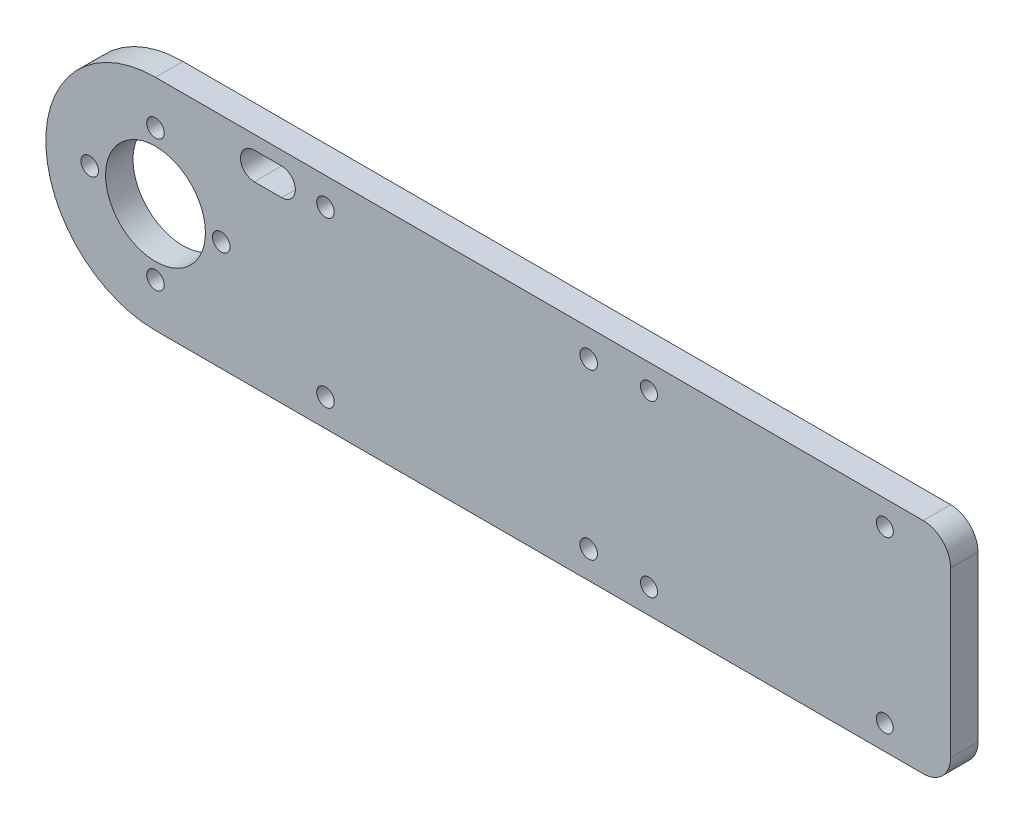
from build123d import *

# Parameters (mm, degrees)
SKETCH2_R           = 9.1
BOSS_EXTRUDE1_DEPTH = 2.5
FILLET1_R           = 5
SKETCH3_R           = 1.55
SKETCH3_R_2         = 1.6
CUT_EXTRUDE1_DEPTH  = 147.458185159
CUT_EXTRUDE2_DEPTH  = 10


with BuildPart() as part:
    # Sketch2 → Boss-Extrude1 (new, symmetric)
    with BuildSketch(Plane.XY):
        with BuildLine():
            Line((145, 20), (0, 20))
            ThreePointArc((0, 20), (-20, 0), (0, -20))
            Line((0, -20), (145, -20))
            Line((145, -20), (145, 20))
        make_face()
        Circle(SKETCH2_R, mode=Mode.SUBTRACT)
    extrude(amount=BOSS_EXTRUDE1_DEPTH, both=True)

    # Fillet1
    fillet1_edges = [part.edges().sort_by_distance(p)[0] for p in [
        (145, -20, 0),
        (145, 20, 0),
    ]]
    fillet(fillet1_edges, radius=FILLET1_R)

    # Sketch3 → Cut-Extrude1 (cut, through all)
    with BuildSketch(Plane(origin=(0, 0, -2.5), x_dir=(-1, 0, 0), z_dir=(0, 0, -1))):
        with Locations((-90, 15.5)):
            Circle(SKETCH3_R)
        with Locations((-79, 15)):
            Circle(SKETCH3_R_2)
        with Locations((0, 12)):
            Circle(SKETCH3_R_2)
        with Locations((-12, 0)):
            Circle(SKETCH3_R_2)
        with Locations((12, 0)):
            Circle(SKETCH3_R_2)
        with Locations((0, -12)):
            Circle(SKETCH3_R_2)
        with Locations((-31, 15)):
            Circle(SKETCH3_R_2)
        with Locations((-90, -15.5)):
            Circle(SKETCH3_R)
        with Locations((-133, -15.5)):
            Circle(SKETCH3_R)
        with Locations((-133, 15.5)):
            Circle(SKETCH3_R)
        with Locations((-79, -15)):
            Circle(SKETCH3_R_2)
        with Locations((-31, -15)):
            Circle(SKETCH3_R_2)
    extrude(amount=-CUT_EXTRUDE1_DEPTH, mode=Mode.SUBTRACT)

    # Sketch3<4> → Cut-Extrude2 (cut)
    with BuildSketch(Plane(origin=(0, 0, -2.5), x_dir=(-1, 0, 0), z_dir=(0, 0, -1))):
        with BuildLine():
            ThreePointArc((-23, 17.5), (-24.767766953, 16.767766953), (-25.5, 15))
            ThreePointArc((-25.5, 15), (-24.767766953, 13.232233047), (-23, 12.5))
            Line((-23, 12.5), (-18, 12.5))
            ThreePointArc((-18, 12.5), (-15.5, 15), (-18, 17.5))
            Line((-18, 17.5), (-23, 17.5))
        make_face()
    extrude(amount=-CUT_EXTRUDE2_DEPTH, mode=Mode.SUBTRACT)


solid = part.part
